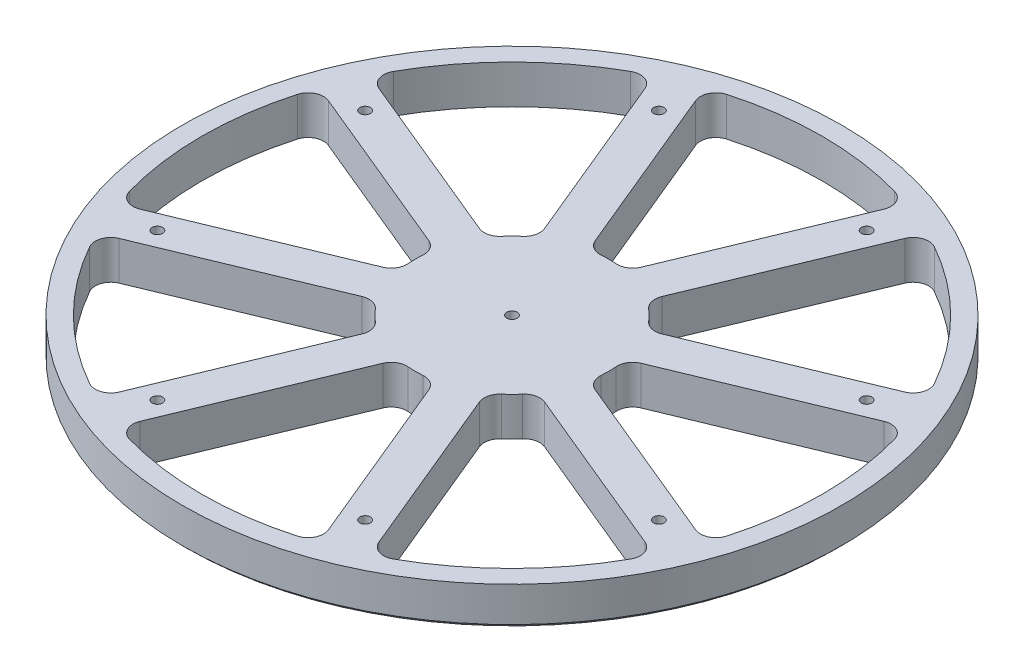
from build123d import *

# Parameters (mm, degrees)
SKETCH2_W                = 84.99983
SKETCH2_H                = 10
F_6_32_TAPPED_HOLE2_D    = 2.7051
CIRPATTERN3_COUNT        = 8
CUT_EXTRUDE1_DEPTH       = 121.623141229
FILLET1_R                = 4
CIRPATTERN4_COUNT        = 8
FILLET1_OF_CIRPATTERN4_R = 4
CHAMFER2_SIZE            = 1
F_6_32_TAPPED_HOLE1_D    = 2.7051


with BuildPart() as part:
    # Sketch2 → Revolve1 (revolve)
    with BuildSketch(Plane(origin=(0, 0, 0), x_dir=(0, 0, -1), z_dir=(1, 0, 0))):
        with Locations((-42.499915, 5)):
            Rectangle(SKETCH2_W, SKETCH2_H)
    revolve(axis=Axis((0, -0.75, 0), (0, 1, 0)))

    # #6-32 Tapped Hole2 (through all)
    with Locations(Plane(origin=(0, 10, 0), x_dir=(1, 0, 0), z_dir=(0, 1, 0))):
        with Locations((-26.787840266, 64.671567276)):
            f_6_32_tapped_hole2 = Hole(F_6_32_TAPPED_HOLE2_D / 2)

    # CirPattern3: #6-32 Tapped Hole2 ×8 about axis
    cirpattern3_axis = Axis((0, -0.75, 0), (0, 1, 0))
    for i in range(1, CIRPATTERN3_COUNT):
        add(f_6_32_tapped_hole2.rotate(cirpattern3_axis, i * 360 / CIRPATTERN3_COUNT), mode=Mode.SUBTRACT)

    # Sketch8 → Cut-Extrude1 (cut, through all)
    with BuildSketch(Plane(origin=(0, 10, 0), x_dir=(1, 0, 0), z_dir=(0, 1, 0))):
        with BuildLine():
            Line((-4.754393761, 24.543751546), (-25.93535895, 75.67912497))
            ThreePointArc((-25.93535895, 75.67912497), (0, 79.99983), (25.93535895, 75.67912497))
            Line((25.93535895, 75.67912497), (4.754393761, 24.543751546))
            ThreePointArc((4.754393761, 24.543751546), (0, 25), (-4.754393761, 24.543751546))
        make_face()
    cut_extrude1 = extrude(amount=-CUT_EXTRUDE1_DEPTH, mode=Mode.SUBTRACT)

    # Fillet1
    fillet1_edges = [part.edges().sort_by_distance(p)[0] for p in [
        (4.754393761, 5, -24.543751546),
        (25.93535895, 5, -75.67912497),
        (-4.754393761, 5, -24.543751546),
        (-25.93535895, 5, -75.67912497),
    ]]
    fillet(fillet1_edges, radius=FILLET1_R)

    # CirPattern4: Cut-Extrude1 ×8 about axis
    cirpattern4_axis = Axis((0, -0.75, 0), (0, 1, 0))
    for i in range(1, CIRPATTERN4_COUNT):
        add(cut_extrude1.rotate(cirpattern4_axis, i * 360 / CIRPATTERN4_COUNT), mode=Mode.SUBTRACT)

    # Fillet1 of CirPattern4
    fillet1_of_cirpattern4_edges = [part.edges().sort_by_distance(p)[0] for p in [
        (-13.993189086, 5, -20.716917223),
        (-35.174154275, 5, -71.852290646),
        (-20.716917223, 5, -13.993189086),
        (-71.852290646, 5, -35.174154275),
        (-24.543751546, 5, -4.754393761),
        (-75.67912497, 5, -25.93535895),
        (-24.543751546, 5, 4.754393761),
        (-75.67912497, 5, 25.93535895),
        (-20.716917223, 5, 13.993189086),
        (-71.852290646, 5, 35.174154275),
        (-13.993189086, 5, 20.716917223),
        (-35.174154275, 5, 71.852290646),
        (-4.754393761, 5, 24.543751546),
        (-25.93535895, 5, 75.67912497),
        (4.754393761, 5, 24.543751546),
        (25.93535895, 5, 75.67912497),
        (13.993189086, 5, 20.716917223),
        (35.174154275, 5, 71.852290646),
        (20.716917223, 5, 13.993189086),
        (71.852290646, 5, 35.174154275),
        (24.543751546, 5, 4.754393761),
        (75.67912497, 5, 25.93535895),
        (24.543751546, 5, -4.754393761),
        (75.67912497, 5, -25.93535895),
        (20.716917223, 5, -13.993189086),
        (71.852290646, 5, -35.174154275),
        (13.993189086, 5, -20.716917223),
        (35.174154275, 5, -71.852290646),
    ]]
    fillet(fillet1_of_cirpattern4_edges, radius=FILLET1_OF_CIRPATTERN4_R)

    # Chamfer2
    chamfer2_edges = [part.edges().sort_by_distance(p)[0] for p in [
        (0, 0, -84.99983),
    ]]
    chamfer(chamfer2_edges, length=CHAMFER2_SIZE)

    # #6-32 Tapped Hole1 (through all)
    with Locations(Plane(origin=(0, 0, 0), x_dir=(-1, 0, 0), z_dir=(0, -1, 0))):
        with Locations((0, 0)):
            Hole(F_6_32_TAPPED_HOLE1_D / 2)


solid = part.part
